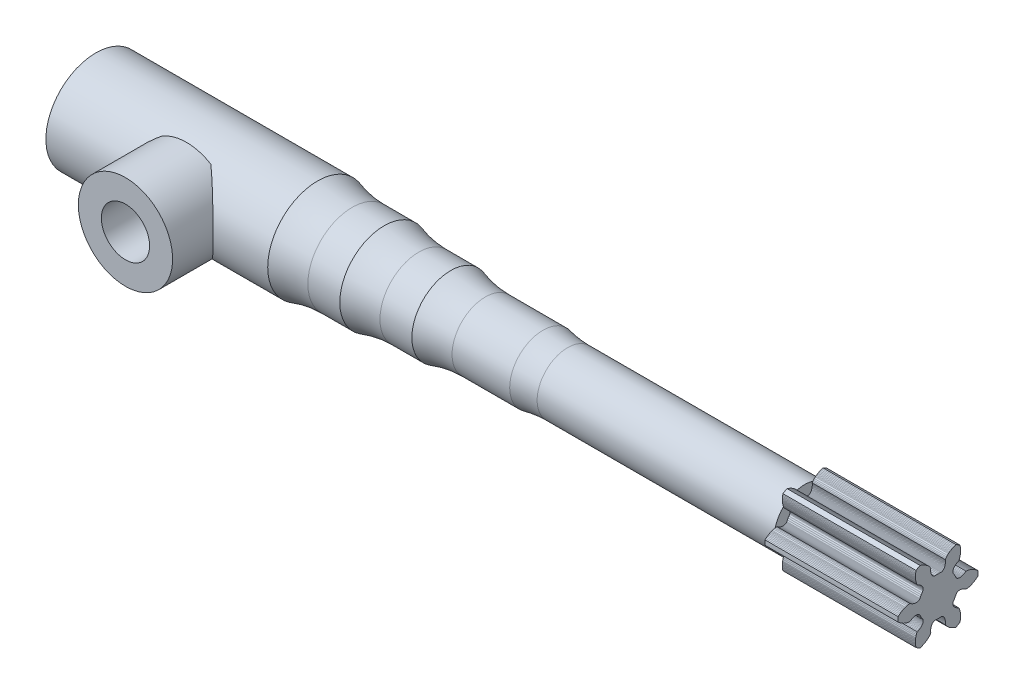
from build123d import *

# Parameters (mm, degrees)
SKETCH1_R           = 4.5
BOSS_EXTRUDE1_DEPTH = 14
SKETCH2_R           = 4.5
BOSS_EXTRUDE2_DEPTH = 6
SKETCH5_R           = 4.25
SKETCH5_R_2         = 2.175
BOSS_EXTRUDE4_DEPTH = 5.5
SKETCH5_2_R         = 2.175
CUT_EXTRUDE2_DEPTH  = 22.711114811
SKETCH3_R           = 4
BOSS_EXTRUDE5_DEPTH = 6
SKETCH6_R           = 3.5
BOSS_EXTRUDE6_DEPTH = 6
SKETCH7_R           = 3
BOSS_EXTRUDE7_DEPTH = 8.32
SKETCH8_R           = 2.75
BOSS_EXTRUDE8_DEPTH = 23.6
BOSS_EXTRUDE9_DEPTH = 12
FILLET1_R           = 10


with BuildPart() as part:
    # Sketch1 → Boss-Extrude1 (new body)
    with BuildSketch(Plane.YZ):
        with Locations(Location((0, 0, 0), (0, 0, 270))):
            Circle(SKETCH1_R)
        with BuildLine():
            Line((-1.509966887, 2.65), (1.509966887, 2.65))
            ThreePointArc((1.509966887, 2.65), (0, -3.05), (-1.509966887, 2.65))
        make_face(mode=Mode.SUBTRACT)
    extrude(amount=BOSS_EXTRUDE1_DEPTH)

    # Sketch2 → Boss-Extrude2 (add)
    with BuildSketch(Plane.YZ.offset(14)):
        with Locations(Location((0, 0, 0), (0, 0, 270))):
            Circle(SKETCH2_R)
    extrude(amount=BOSS_EXTRUDE2_DEPTH)

    # Sketch5 → Boss-Extrude4 (add)
    with BuildSketch(Plane(origin=(0, 0, 2.65), x_dir=(1, 0, 0), z_dir=(0, 0, -1))):
        with Locations(Location((10.825, 0, 0), (0, 0, 180))):
            Circle(SKETCH5_R)
        with Locations(Location((10.825, 0, 0), (0, 0, 180))):
            Circle(SKETCH5_R_2, mode=Mode.SUBTRACT)
    extrude(amount=-BOSS_EXTRUDE4_DEPTH)

    # Sketch5<2> → Cut-Extrude2 (cut, through all)
    with BuildSketch(Plane(origin=(0, 0, 2.65), x_dir=(1, 0, 0), z_dir=(0, 0, -1))):
        with Locations(Location((10.825, 0, 0), (0, 0, 180))):
            Circle(SKETCH5_2_R)
    extrude(amount=-CUT_EXTRUDE2_DEPTH, mode=Mode.SUBTRACT)

    # Sketch3 → Boss-Extrude5 (add)
    with BuildSketch(Plane.YZ.offset(20)):
        with Locations(Location((0, 0, 0), (0, 0, 270))):
            Circle(SKETCH3_R)
    extrude(amount=BOSS_EXTRUDE5_DEPTH)

    # Sketch6 → Boss-Extrude6 (add)
    with BuildSketch(Plane.YZ.offset(26)):
        with Locations(Location((0, 0, 0), (0, 0, 270))):
            Circle(SKETCH6_R)
    extrude(amount=BOSS_EXTRUDE6_DEPTH)

    # Sketch7 → Boss-Extrude7 (add)
    with BuildSketch(Plane.YZ.offset(32)):
        with Locations(Location((0, 0, 0), (0, 0, 270))):
            Circle(SKETCH7_R)
    extrude(amount=BOSS_EXTRUDE7_DEPTH)

    # Sketch8 → Boss-Extrude8 (add)
    with BuildSketch(Plane.YZ.offset(40.32)):
        with Locations(Location((0, 0, 0), (0, 0, 270))):
            Circle(SKETCH8_R)
    extrude(amount=BOSS_EXTRUDE8_DEPTH)

    # Sketch10 → Boss-Extrude9 (add)
    with BuildSketch(Plane.YZ.offset(63.92)):
        with BuildLine():
            Line((-0.267585513, -3.548852444), (-0.329356213, -3.471042444))
            Line((-0.329356213, -3.471042444), (-0.386234913, -3.392939244))
            Line((-0.386234913, -3.392939244), (-0.437003313, -3.316712644))
            Line((-0.437003313, -3.316712644), (-0.483004413, -3.240929044))
            Line((-0.483004413, -3.240929044), (-0.522210513, -3.169795944))
            Line((-0.522210513, -3.169795944), (-0.557776213, -3.098397544))
            Line((-0.557776213, -3.098397544), (-0.587674813, -3.031483444))
            Line((-0.587674813, -3.031483444), (-0.613745313, -2.965878844))
            Line((-0.613745313, -2.965878844), (-0.653275913, -2.844767744))
            Line((-0.653275913, -2.844767744), (-0.677852113, -2.740535144))
            Line((-0.677852113, -2.740535144), (-0.691225313, -2.651038144))
            Line((-0.691225313, -2.651038144), (-0.695897213, -2.578770144))
            Line((-0.695897213, -2.578770144), (-0.695795613, -2.544534244))
            Line((-0.695795613, -2.544534244), (-0.645266113, -2.474114544))
            Line((-0.645266113, -2.474114544), (-0.600691913, -2.402369644))
            Line((-0.600691913, -2.402369644), (-0.563164913, -2.331371144))
            Line((-0.563164913, -2.331371144), (-0.532547213, -2.261579644))
            Line((-0.532547213, -2.261579644), (-0.508658313, -2.193422844))
            Line((-0.508658313, -2.193422844), (-0.491296813, -2.127351744))
            Line((-0.491296813, -2.127351744), (-0.480246213, -2.063791644))
            Line((-0.480246213, -2.063791644), (-0.475252913, -2.003142944))
            Line((-0.475252913, -2.003142944), (-0.476058013, -1.945797444))
            Line((-0.476058013, -1.945797444), (-0.482370713, -1.892131244))
            Line((-0.482370713, -1.892131244), (-0.493862413, -1.842495444))
            Line((-0.493862413, -1.842495444), (-0.510212113, -1.797214044))
            Line((-0.510212113, -1.797214044), (-0.531072813, -1.756625944))
            Line((-0.531072813, -1.756625944), (-0.556074813, -1.720990644))
            Line((-0.556074813, -1.720990644), (-0.584832513, -1.690600344))
            Line((-0.584832513, -1.690600344), (-0.616947313, -1.665684844))
            Line((-0.616947313, -1.665684844), (-0.634136113, -1.655356744))
            Line((-0.634136113, -1.655356744), (-0.751810413, -1.602174544))
            Line((-0.751810413, -1.602174544), (-0.869368213, -1.540110644))
            Line((-0.869368213, -1.540110644), (-0.981896013, -1.469334544))
            Line((-0.981896013, -1.469334544), (-1.086790313, -1.394016744))
            Line((-1.086790313, -1.394016744), (-1.104329113, -1.384294844))
            Line((-1.104329113, -1.384294844), (-1.141963913, -1.368940344))
            Line((-1.141963913, -1.368940344), (-1.182661513, -1.359230644))
            Line((-1.182661513, -1.359230644), (-1.226023613, -1.355395944))
            Line((-1.226023613, -1.355395944), (-1.271604313, -1.357624044))
            Line((-1.271604313, -1.357624044), (-1.318994013, -1.366105444))
            Line((-1.318994013, -1.366105444), (-1.367725713, -1.380971244))
            Line((-1.367725713, -1.380971244), (-1.417358413, -1.402337444))
            Line((-1.417358413, -1.402337444), (-1.467423513, -1.430312944))
            Line((-1.467423513, -1.430312944), (-1.517450213, -1.464961644))
            Line((-1.517450213, -1.464961644), (-1.566969613, -1.506311744))
            Line((-1.566969613, -1.506311744), (-1.615508113, -1.554382844))
            Line((-1.615508113, -1.554382844), (-1.662589213, -1.609149644))
            Line((-1.662589213, -1.609149644), (-1.707721413, -1.670561144))
            Line((-1.707721413, -1.670561144), (-1.750444513, -1.738559644))
            Line((-1.750444513, -1.738559644), (-1.790290313, -1.813034544))
            Line((-1.790290313, -1.813034544), (-1.826010813, -1.892004244))
            Line((-1.826010813, -1.892004244), (-1.855609213, -1.909210144))
            Line((-1.855609213, -1.909210144), (-1.920531113, -1.941298144))
            Line((-1.920531113, -1.941298144), (-2.004724313, -1.974465144))
            Line((-2.004724313, -1.974465144), (-2.107280513, -2.005297744))
            Line((-2.107280513, -2.005297744), (-2.231931113, -2.031618844))
            Line((-2.231931113, -2.031618844), (-2.301781613, -2.041843444))
            Line((-2.301781613, -2.041843444), (-2.374680213, -2.049407544))
            Line((-2.374680213, -2.049407544), (-2.454295913, -2.054305944))
            Line((-2.454295913, -2.054305944), (-2.535502013, -2.055919044))
            Line((-2.535502013, -2.055919044), (-2.624133113, -2.053972644))
            Line((-2.624133113, -2.053972644), (-2.715531513, -2.048119244))
            Line((-2.715531513, -2.048119244), (-2.811610213, -2.037912444))
            Line((-2.811610213, -2.037912444), (-2.909880913, -2.023322444))
            Line((-2.909880913, -2.023322444), (-3.004720513, -2.005193244))
            ThreePointArc((-3.004720513, -2.005193244), (-3.11595463, -1.824967499), (-3.216417616, -1.63852304))
            Line((-3.216417616, -1.63852304), (-3.184698184, -1.547324921))
            Line((-3.184698184, -1.547324921), (-3.148198184, -1.454924921))
            Line((-3.148198184, -1.454924921), (-3.108998184, -1.366614921))
            Line((-3.108998184, -1.366614921), (-3.068368184, -1.284534921))
            Line((-3.068368184, -1.284534921), (-3.025738184, -1.206804921))
            Line((-3.025738184, -1.206804921), (-2.983738184, -1.137284921))
            Line((-2.983738184, -1.137284921), (-2.939688184, -1.070784921))
            Line((-2.939688184, -1.070784921), (-2.896688184, -1.011434921))
            Line((-2.896688184, -1.011434921), (-2.852908184, -0.956054921))
            Line((-2.852908184, -0.956054921), (-2.767788184, -0.861264921))
            Line((-2.767788184, -0.861264921), (-2.689808184, -0.787864921))
            Line((-2.689808184, -0.787864921), (-2.618988184, -0.731534921))
            Line((-2.618988184, -0.731534921), (-2.558738184, -0.691354921))
            Line((-2.558738184, -0.691354921), (-2.529038184, -0.674324921))
            Line((-2.529038184, -0.674324921), (-2.442788184, -0.682874921))
            Line((-2.442788184, -0.682874921), (-2.358368184, -0.685604921))
            Line((-2.358368184, -0.685604921), (-2.278118184, -0.682604921))
            Line((-2.278118184, -0.682604921), (-2.202368184, -0.674224921))
            Line((-2.202368184, -0.674224921), (-2.131398184, -0.660834921))
            Line((-2.131398184, -0.660834921), (-2.065498184, -0.642834921))
            Line((-2.065498184, -0.642834921), (-2.004928184, -0.620624921))
            Line((-2.004928184, -0.620624921), (-1.949908184, -0.594624921))
            Line((-1.949908184, -0.594624921), (-1.900648184, -0.565254921))
            Line((-1.900648184, -0.565254921), (-1.857328184, -0.532954921))
            Line((-1.857328184, -0.532954921), (-1.820088184, -0.498184921))
            Line((-1.820088184, -0.498184921), (-1.789048184, -0.461384921))
            Line((-1.789048184, -0.461384921), (-1.764328184, -0.423024921))
            Line((-1.764328184, -0.423024921), (-1.745968184, -0.383554921))
            Line((-1.745968184, -0.383554921), (-1.734028184, -0.343454921))
            Line((-1.734028184, -0.343454921), (-1.728508184, -0.303184921))
            Line((-1.728508184, -0.303184921), (-1.728158184, -0.283134921))
            Line((-1.728158184, -0.283134921), (-1.740938184, -0.154634921))
            Line((-1.740938184, -0.154634921), (-1.745968184, -0.021794921))
            Line((-1.745968184, -0.021794921), (-1.740938184, 0.111045079))
            Line((-1.740938184, 0.111045079), (-1.728158184, 0.239545079))
            Line((-1.728158184, 0.239545079), (-1.728508184, 0.259595079))
            Line((-1.728508184, 0.259595079), (-1.734028184, 0.299865079))
            Line((-1.734028184, 0.299865079), (-1.745968184, 0.339965079))
            Line((-1.745968184, 0.339965079), (-1.764328184, 0.379435079))
            Line((-1.764328184, 0.379435079), (-1.789048184, 0.417795079))
            Line((-1.789048184, 0.417795079), (-1.820088184, 0.454595079))
            Line((-1.820088184, 0.454595079), (-1.857328184, 0.489365079))
            Line((-1.857328184, 0.489365079), (-1.900648184, 0.521665079))
            Line((-1.900648184, 0.521665079), (-1.949908184, 0.551035079))
            Line((-1.949908184, 0.551035079), (-2.004928184, 0.577035079))
            Line((-2.004928184, 0.577035079), (-2.065498184, 0.599245079))
            Line((-2.065498184, 0.599245079), (-2.131398184, 0.617245079))
            Line((-2.131398184, 0.617245079), (-2.202368184, 0.630635079))
            Line((-2.202368184, 0.630635079), (-2.278118184, 0.639015079))
            Line((-2.278118184, 0.639015079), (-2.358368184, 0.642015079))
            Line((-2.358368184, 0.642015079), (-2.442788184, 0.639285079))
            Line((-2.442788184, 0.639285079), (-2.529038184, 0.630735079))
            Line((-2.529038184, 0.630735079), (-2.558738184, 0.647765079))
            Line((-2.558738184, 0.647765079), (-2.618988184, 0.687945079))
            Line((-2.618988184, 0.687945079), (-2.689808184, 0.744275079))
            Line((-2.689808184, 0.744275079), (-2.767788184, 0.817675079))
            Line((-2.767788184, 0.817675079), (-2.852908184, 0.912465079))
            Line((-2.852908184, 0.912465079), (-2.896688184, 0.967845079))
            Line((-2.896688184, 0.967845079), (-2.939688184, 1.027195079))
            Line((-2.939688184, 1.027195079), (-2.983738184, 1.093695079))
            Line((-2.983738184, 1.093695079), (-3.025738184, 1.163215079))
            Line((-3.025738184, 1.163215079), (-3.068368184, 1.240945079))
            Line((-3.068368184, 1.240945079), (-3.108998184, 1.323025079))
            Line((-3.108998184, 1.323025079), (-3.148198184, 1.411335079))
            Line((-3.148198184, 1.411335079), (-3.184698184, 1.503735079))
            Line((-3.184698184, 1.503735079), (-3.216417684, 1.594933179))
            ThreePointArc((-3.216417684, 1.594933179), (-3.115954701, 1.781377635), (-3.004720588, 1.961603378))
            Line((-3.004720588, 1.961603378), (-2.909880929, 1.979732605))
            Line((-2.909880929, 1.979732605), (-2.811610229, 1.994322605))
            Line((-2.811610229, 1.994322605), (-2.715531529, 2.004529405))
            Line((-2.715531529, 2.004529405), (-2.624133129, 2.010382805))
            Line((-2.624133129, 2.010382805), (-2.535502029, 2.012329205))
            Line((-2.535502029, 2.012329205), (-2.454295929, 2.010716105))
            Line((-2.454295929, 2.010716105), (-2.374680229, 2.005817705))
            Line((-2.374680229, 2.005817705), (-2.301781629, 1.998253605))
            Line((-2.301781629, 1.998253605), (-2.231931129, 1.988029005))
            Line((-2.231931129, 1.988029005), (-2.107280529, 1.961707905))
            Line((-2.107280529, 1.961707905), (-2.004724329, 1.930875305))
            Line((-2.004724329, 1.930875305), (-1.920531129, 1.897708305))
            Line((-1.920531129, 1.897708305), (-1.855609229, 1.865620305))
            Line((-1.855609229, 1.865620305), (-1.826010829, 1.848414405))
            Line((-1.826010829, 1.848414405), (-1.790290329, 1.769444705))
            Line((-1.790290329, 1.769444705), (-1.750444529, 1.694969805))
            Line((-1.750444529, 1.694969805), (-1.707721429, 1.626971305))
            Line((-1.707721429, 1.626971305), (-1.662589229, 1.565559805))
            Line((-1.662589229, 1.565559805), (-1.615508129, 1.510793005))
            Line((-1.615508129, 1.510793005), (-1.566969629, 1.462721905))
            Line((-1.566969629, 1.462721905), (-1.517450229, 1.421371805))
            Line((-1.517450229, 1.421371805), (-1.467423529, 1.386723105))
            Line((-1.467423529, 1.386723105), (-1.417358429, 1.358747605))
            Line((-1.417358429, 1.358747605), (-1.367725729, 1.337381405))
            Line((-1.367725729, 1.337381405), (-1.318994029, 1.322515605))
            Line((-1.318994029, 1.322515605), (-1.271604329, 1.314034205))
            Line((-1.271604329, 1.314034205), (-1.226023629, 1.311806105))
            Line((-1.226023629, 1.311806105), (-1.182661529, 1.315640805))
            Line((-1.182661529, 1.315640805), (-1.141963929, 1.325350505))
            Line((-1.141963929, 1.325350505), (-1.104329129, 1.340705005))
            Line((-1.104329129, 1.340705005), (-1.086790329, 1.350426905))
            Line((-1.086790329, 1.350426905), (-0.981896029, 1.425744705))
            Line((-0.981896029, 1.425744705), (-0.869368229, 1.496520805))
            Line((-0.869368229, 1.496520805), (-0.751810429, 1.558584705))
            Line((-0.751810429, 1.558584705), (-0.634136129, 1.611766905))
            Line((-0.634136129, 1.611766905), (-0.616947329, 1.622095005))
            Line((-0.616947329, 1.622095005), (-0.584832529, 1.647010505))
            Line((-0.584832529, 1.647010505), (-0.556074829, 1.677400805))
            Line((-0.556074829, 1.677400805), (-0.531072829, 1.713036105))
            Line((-0.531072829, 1.713036105), (-0.510212129, 1.753624205))
            Line((-0.510212129, 1.753624205), (-0.493862429, 1.798905605))
            Line((-0.493862429, 1.798905605), (-0.482370729, 1.848541405))
            Line((-0.482370729, 1.848541405), (-0.476058029, 1.902207605))
            Line((-0.476058029, 1.902207605), (-0.475252929, 1.959553105))
            Line((-0.475252929, 1.959553105), (-0.480246229, 2.020201805))
            Line((-0.480246229, 2.020201805), (-0.491296829, 2.083761905))
            Line((-0.491296829, 2.083761905), (-0.508658329, 2.149833005))
            Line((-0.508658329, 2.149833005), (-0.532547229, 2.217989805))
            Line((-0.532547229, 2.217989805), (-0.563164929, 2.287781305))
            Line((-0.563164929, 2.287781305), (-0.600691929, 2.358779805))
            Line((-0.600691929, 2.358779805), (-0.645266129, 2.430524705))
            Line((-0.645266129, 2.430524705), (-0.695795629, 2.500944405))
            Line((-0.695795629, 2.500944405), (-0.695897229, 2.535180305))
            Line((-0.695897229, 2.535180305), (-0.691225329, 2.607448305))
            Line((-0.691225329, 2.607448305), (-0.677852129, 2.696945305))
            Line((-0.677852129, 2.696945305), (-0.653275929, 2.801177905))
            Line((-0.653275929, 2.801177905), (-0.613745329, 2.922289005))
            Line((-0.613745329, 2.922289005), (-0.587674829, 2.987893605))
            Line((-0.587674829, 2.987893605), (-0.557776229, 3.054807705))
            Line((-0.557776229, 3.054807705), (-0.522210529, 3.126206105))
            Line((-0.522210529, 3.126206105), (-0.483004429, 3.197339205))
            Line((-0.483004429, 3.197339205), (-0.437003329, 3.273122805))
            Line((-0.437003329, 3.273122805), (-0.386234929, 3.349349405))
            Line((-0.386234929, 3.349349405), (-0.329356229, 3.427452605))
            Line((-0.329356229, 3.427452605), (-0.267585529, 3.505262605))
            Line((-0.267585529, 3.505262605), (-0.204465329, 3.578331505))
            ThreePointArc((-0.204465329, 3.578331505), (0.007231821, 3.584550218), (0.21892897, 3.578331499))
            Line((0.21892897, 3.578331499), (0.282049071, 3.505262618))
            Line((0.282049071, 3.505262618), (0.343819771, 3.427452618))
            Line((0.343819771, 3.427452618), (0.400698471, 3.349349418))
            Line((0.400698471, 3.349349418), (0.451466871, 3.273122818))
            Line((0.451466871, 3.273122818), (0.497467971, 3.197339218))
            Line((0.497467971, 3.197339218), (0.536674071, 3.126206118))
            Line((0.536674071, 3.126206118), (0.572239771, 3.054807718))
            Line((0.572239771, 3.054807718), (0.602138371, 2.987893618))
            Line((0.602138371, 2.987893618), (0.628208871, 2.922289018))
            Line((0.628208871, 2.922289018), (0.667739471, 2.801177918))
            Line((0.667739471, 2.801177918), (0.692315671, 2.696945318))
            Line((0.692315671, 2.696945318), (0.705688871, 2.607448318))
            Line((0.705688871, 2.607448318), (0.710360771, 2.535180318))
            Line((0.710360771, 2.535180318), (0.710259171, 2.500944418))
            Line((0.710259171, 2.500944418), (0.659729671, 2.430524718))
            Line((0.659729671, 2.430524718), (0.615155471, 2.358779818))
            Line((0.615155471, 2.358779818), (0.577628571, 2.287781318))
            Line((0.577628571, 2.287781318), (0.547010771, 2.217989818))
            Line((0.547010771, 2.217989818), (0.523121871, 2.149833018))
            Line((0.523121871, 2.149833018), (0.505760371, 2.083761918))
            Line((0.505760371, 2.083761918), (0.494709771, 2.020201818))
            Line((0.494709771, 2.020201818), (0.489716471, 1.959553118))
            Line((0.489716471, 1.959553118), (0.490521571, 1.902207618))
            Line((0.490521571, 1.902207618), (0.496834271, 1.848541418))
            Line((0.496834271, 1.848541418), (0.508325971, 1.798905618))
            Line((0.508325971, 1.798905618), (0.524675671, 1.753624218))
            Line((0.524675671, 1.753624218), (0.545536371, 1.713036118))
            Line((0.545536371, 1.713036118), (0.570538471, 1.677400818))
            Line((0.570538471, 1.677400818), (0.599296071, 1.647010518))
            Line((0.599296071, 1.647010518), (0.631410871, 1.622095018))
            Line((0.631410871, 1.622095018), (0.648599671, 1.611766918))
            Line((0.648599671, 1.611766918), (0.766273971, 1.558584718))
            Line((0.766273971, 1.558584718), (0.883831771, 1.496520818))
            Line((0.883831771, 1.496520818), (0.996359571, 1.425744718))
            Line((0.996359571, 1.425744718), (1.101253871, 1.350426918))
            Line((1.101253871, 1.350426918), (1.118792671, 1.340705018))
            Line((1.118792671, 1.340705018), (1.156427471, 1.325350518))
            Line((1.156427471, 1.325350518), (1.197125171, 1.315640818))
            Line((1.197125171, 1.315640818), (1.240487171, 1.311806118))
            Line((1.240487171, 1.311806118), (1.286067871, 1.314034218))
            Line((1.286067871, 1.314034218), (1.333457571, 1.322515618))
            Line((1.333457571, 1.322515618), (1.382189271, 1.337381418))
            Line((1.382189271, 1.337381418), (1.431821971, 1.358747618))
            Line((1.431821971, 1.358747618), (1.481887071, 1.386723118))
            Line((1.481887071, 1.386723118), (1.531913771, 1.421371818))
            Line((1.531913771, 1.421371818), (1.581433171, 1.462721918))
            Line((1.581433171, 1.462721918), (1.629971671, 1.510793018))
            Line((1.629971671, 1.510793018), (1.677052771, 1.565559818))
            Line((1.677052771, 1.565559818), (1.722185071, 1.626971318))
            Line((1.722185071, 1.626971318), (1.764908071, 1.694969818))
            Line((1.764908071, 1.694969818), (1.804753871, 1.769444718))
            Line((1.804753871, 1.769444718), (1.840474371, 1.848414418))
            Line((1.840474371, 1.848414418), (1.870072771, 1.865620318))
            Line((1.870072771, 1.865620318), (1.934994671, 1.897708318))
            Line((1.934994671, 1.897708318), (2.019187871, 1.930875318))
            Line((2.019187871, 1.930875318), (2.121744071, 1.961707918))
            Line((2.121744071, 1.961707918), (2.246394671, 1.988029018))
            Line((2.246394671, 1.988029018), (2.316245171, 1.998253618))
            Line((2.316245171, 1.998253618), (2.389143771, 2.005817718))
            Line((2.389143771, 2.005817718), (2.468759471, 2.010716118))
            Line((2.468759471, 2.010716118), (2.549965571, 2.012329218))
            Line((2.549965571, 2.012329218), (2.638596671, 2.010382818))
            Line((2.638596671, 2.010382818), (2.729995071, 2.004529418))
            Line((2.729995071, 2.004529418), (2.826073771, 1.994322618))
            Line((2.826073771, 1.994322618), (2.924344471, 1.979732618))
            Line((2.924344471, 1.979732618), (3.019184071, 1.961603418))
            ThreePointArc((3.019184071, 1.961603418), (3.130418187, 1.781377677), (3.230881173, 1.59493322))
            Line((3.230881173, 1.59493322), (3.199161741, 1.503735101))
            Line((3.199161741, 1.503735101), (3.162661741, 1.411335101))
            Line((3.162661741, 1.411335101), (3.123461741, 1.323025101))
            Line((3.123461741, 1.323025101), (3.082831741, 1.240945101))
            Line((3.082831741, 1.240945101), (3.040201741, 1.163215101))
            Line((3.040201741, 1.163215101), (2.998201741, 1.093695101))
            Line((2.998201741, 1.093695101), (2.954151741, 1.027195101))
            Line((2.954151741, 1.027195101), (2.911151741, 0.967845101))
            Line((2.911151741, 0.967845101), (2.867371741, 0.912465101))
            Line((2.867371741, 0.912465101), (2.782251741, 0.817675101))
            Line((2.782251741, 0.817675101), (2.704271741, 0.744275101))
            Line((2.704271741, 0.744275101), (2.633451741, 0.687945101))
            Line((2.633451741, 0.687945101), (2.573201741, 0.647765101))
            Line((2.573201741, 0.647765101), (2.543501741, 0.630735101))
            Line((2.543501741, 0.630735101), (2.457251741, 0.639285101))
            Line((2.457251741, 0.639285101), (2.372831741, 0.642015101))
            Line((2.372831741, 0.642015101), (2.292581741, 0.639015101))
            Line((2.292581741, 0.639015101), (2.216831741, 0.630635101))
            Line((2.216831741, 0.630635101), (2.145861741, 0.617245101))
            Line((2.145861741, 0.617245101), (2.079961741, 0.599245101))
            Line((2.079961741, 0.599245101), (2.019391741, 0.577035101))
            Line((2.019391741, 0.577035101), (1.964371741, 0.551035101))
            Line((1.964371741, 0.551035101), (1.915111741, 0.521665101))
            Line((1.915111741, 0.521665101), (1.871791741, 0.489365101))
            Line((1.871791741, 0.489365101), (1.834551741, 0.454595101))
            Line((1.834551741, 0.454595101), (1.803511741, 0.417795101))
            Line((1.803511741, 0.417795101), (1.778791741, 0.379435101))
            Line((1.778791741, 0.379435101), (1.760431741, 0.339965101))
            Line((1.760431741, 0.339965101), (1.748491741, 0.299865101))
            Line((1.748491741, 0.299865101), (1.742971741, 0.259595101))
            Line((1.742971741, 0.259595101), (1.742621741, 0.239545101))
            Line((1.742621741, 0.239545101), (1.755401741, 0.111045101))
            Line((1.755401741, 0.111045101), (1.760431741, -0.021794899))
            Line((1.760431741, -0.021794899), (1.755401741, -0.154634899))
            Line((1.755401741, -0.154634899), (1.742621741, -0.283134899))
            Line((1.742621741, -0.283134899), (1.742971741, -0.303184899))
            Line((1.742971741, -0.303184899), (1.748491741, -0.343454899))
            Line((1.748491741, -0.343454899), (1.760431741, -0.383554899))
            Line((1.760431741, -0.383554899), (1.778791741, -0.423024899))
            Line((1.778791741, -0.423024899), (1.803511741, -0.461384899))
            Line((1.803511741, -0.461384899), (1.834551741, -0.498184899))
            Line((1.834551741, -0.498184899), (1.871791741, -0.532954899))
            Line((1.871791741, -0.532954899), (1.915111741, -0.565254899))
            Line((1.915111741, -0.565254899), (1.964371741, -0.594624899))
            Line((1.964371741, -0.594624899), (2.019391741, -0.620624899))
            Line((2.019391741, -0.620624899), (2.079961741, -0.642834899))
            Line((2.079961741, -0.642834899), (2.145861741, -0.660834899))
            Line((2.145861741, -0.660834899), (2.216831741, -0.674224899))
            Line((2.216831741, -0.674224899), (2.292581741, -0.682604899))
            Line((2.292581741, -0.682604899), (2.372831741, -0.685604899))
            Line((2.372831741, -0.685604899), (2.457251741, -0.682874899))
            Line((2.457251741, -0.682874899), (2.543501741, -0.674324899))
            Line((2.543501741, -0.674324899), (2.573201741, -0.691354899))
            Line((2.573201741, -0.691354899), (2.633451741, -0.731534899))
            Line((2.633451741, -0.731534899), (2.704271741, -0.787864899))
            Line((2.704271741, -0.787864899), (2.782251741, -0.861264899))
            Line((2.782251741, -0.861264899), (2.867371741, -0.956054899))
            Line((2.867371741, -0.956054899), (2.911151741, -1.011434899))
            Line((2.911151741, -1.011434899), (2.954151741, -1.070784899))
            Line((2.954151741, -1.070784899), (2.998201741, -1.137284899))
            Line((2.998201741, -1.137284899), (3.040201741, -1.206804899))
            Line((3.040201741, -1.206804899), (3.082831741, -1.284534899))
            Line((3.082831741, -1.284534899), (3.123461741, -1.366614899))
            Line((3.123461741, -1.366614899), (3.162661741, -1.454924899))
            Line((3.162661741, -1.454924899), (3.199161741, -1.547324899))
            Line((3.199161741, -1.547324899), (3.230881241, -1.638522999))
            ThreePointArc((3.230881241, -1.638522999), (3.130418259, -1.824967455), (3.019184145, -2.005193197))
            Line((3.019184145, -2.005193197), (2.924344487, -2.023322425))
            Line((2.924344487, -2.023322425), (2.826073787, -2.037912425))
            Line((2.826073787, -2.037912425), (2.729995087, -2.048119225))
            Line((2.729995087, -2.048119225), (2.638596687, -2.053972625))
            Line((2.638596687, -2.053972625), (2.549965587, -2.055919025))
            Line((2.549965587, -2.055919025), (2.468759487, -2.054305925))
            Line((2.468759487, -2.054305925), (2.389143787, -2.049407525))
            Line((2.389143787, -2.049407525), (2.316245187, -2.041843425))
            Line((2.316245187, -2.041843425), (2.246394687, -2.031618825))
            Line((2.246394687, -2.031618825), (2.121744087, -2.005297725))
            Line((2.121744087, -2.005297725), (2.019187887, -1.974465125))
            Line((2.019187887, -1.974465125), (1.934994687, -1.941298125))
            Line((1.934994687, -1.941298125), (1.870072787, -1.909210125))
            Line((1.870072787, -1.909210125), (1.840474387, -1.892004225))
            Line((1.840474387, -1.892004225), (1.804753887, -1.813034525))
            Line((1.804753887, -1.813034525), (1.764908087, -1.738559625))
            Line((1.764908087, -1.738559625), (1.722185087, -1.670561125))
            Line((1.722185087, -1.670561125), (1.677052787, -1.609149625))
            Line((1.677052787, -1.609149625), (1.629971687, -1.554382825))
            Line((1.629971687, -1.554382825), (1.581433187, -1.506311725))
            Line((1.581433187, -1.506311725), (1.531913787, -1.464961625))
            Line((1.531913787, -1.464961625), (1.481887087, -1.430312925))
            Line((1.481887087, -1.430312925), (1.431821987, -1.402337425))
            Line((1.431821987, -1.402337425), (1.382189287, -1.380971225))
            Line((1.382189287, -1.380971225), (1.333457587, -1.366105425))
            Line((1.333457587, -1.366105425), (1.286067887, -1.357624025))
            Line((1.286067887, -1.357624025), (1.240487187, -1.355395925))
            Line((1.240487187, -1.355395925), (1.197125187, -1.359230625))
            Line((1.197125187, -1.359230625), (1.156427487, -1.368940325))
            Line((1.156427487, -1.368940325), (1.118792687, -1.384294825))
            Line((1.118792687, -1.384294825), (1.101253887, -1.394016725))
            Line((1.101253887, -1.394016725), (0.996359587, -1.469334525))
            Line((0.996359587, -1.469334525), (0.883831787, -1.540110625))
            Line((0.883831787, -1.540110625), (0.766273987, -1.602174525))
            Line((0.766273987, -1.602174525), (0.648599687, -1.655356725))
            Line((0.648599687, -1.655356725), (0.631410887, -1.665684825))
            Line((0.631410887, -1.665684825), (0.599296087, -1.690600325))
            Line((0.599296087, -1.690600325), (0.570538487, -1.720990625))
            Line((0.570538487, -1.720990625), (0.545536387, -1.756625925))
            Line((0.545536387, -1.756625925), (0.524675687, -1.797214025))
            Line((0.524675687, -1.797214025), (0.508325987, -1.842495425))
            Line((0.508325987, -1.842495425), (0.496834287, -1.892131225))
            Line((0.496834287, -1.892131225), (0.490521587, -1.945797425))
            Line((0.490521587, -1.945797425), (0.489716487, -2.003142925))
            Line((0.489716487, -2.003142925), (0.494709787, -2.063791625))
            Line((0.494709787, -2.063791625), (0.505760387, -2.127351725))
            Line((0.505760387, -2.127351725), (0.523121887, -2.193422825))
            Line((0.523121887, -2.193422825), (0.547010787, -2.261579625))
            Line((0.547010787, -2.261579625), (0.577628587, -2.331371125))
            Line((0.577628587, -2.331371125), (0.615155487, -2.402369625))
            Line((0.615155487, -2.402369625), (0.659729687, -2.474114525))
            Line((0.659729687, -2.474114525), (0.710259187, -2.544534225))
            Line((0.710259187, -2.544534225), (0.710360787, -2.578770125))
            Line((0.710360787, -2.578770125), (0.705688887, -2.651038125))
            Line((0.705688887, -2.651038125), (0.692315687, -2.740535125))
            Line((0.692315687, -2.740535125), (0.667739487, -2.844767725))
            Line((0.667739487, -2.844767725), (0.628208887, -2.965878825))
            Line((0.628208887, -2.965878825), (0.602138387, -3.031483425))
            Line((0.602138387, -3.031483425), (0.572239787, -3.098397525))
            Line((0.572239787, -3.098397525), (0.536674087, -3.169795925))
            Line((0.536674087, -3.169795925), (0.497467987, -3.240929025))
            Line((0.497467987, -3.240929025), (0.451466887, -3.316712625))
            Line((0.451466887, -3.316712625), (0.400698487, -3.392939225))
            Line((0.400698487, -3.392939225), (0.343819787, -3.471042425))
            Line((0.343819787, -3.471042425), (0.282049087, -3.548852425))
            Line((0.282049087, -3.548852425), (0.218928987, -3.621921325))
            ThreePointArc((0.218928987, -3.621921325), (0.007231837, -3.628140044), (-0.204465312, -3.621921331))
            Line((-0.204465312, -3.621921331), (-0.267585513, -3.548852444))
        make_face()
    extrude(amount=BOSS_EXTRUDE9_DEPTH)

    # Fillet1
    # the kernel refuses this fillet: 10 mm, written as the material it adds along each edge
    with BuildSketch(Plane(origin=(20, 0, 0), x_dir=(0, 0, -1), z_dir=(0, -1, 0))) as fillet1_piece_1:
        with BuildLine():
            CenterArc((14, 3.122498999), FILLET1_R, 180, 18.194872339)
            Line((4, 3.122498999), (3.8, 3.122498999))
            Line((3.8, 3.122498999), (3.8, 0))
            Line((3.8, 0), (4, -0.2))
            ThreePointArc((4, -0.2), (4.25, -0.2), (4.31, -0.06244998))
            Line((4.31, -0.06244998), (4.5, 0))
        make_face()
    revolve(axis=Axis((20, 0, 0), (1, 0, 0)))
    with BuildSketch(Plane(origin=(26, 0, 0), x_dir=(0, 0, -1), z_dir=(0, -1, 0))) as fillet1_piece_2:
        with BuildLine():
            CenterArc((13.5, 3.122498999), FILLET1_R, 180, 18.194872339)
            Line((3.5, 3.122498999), (3.3, 3.122498999))
            Line((3.3, 3.122498999), (3.3, 0))
            Line((3.3, 0), (3.5, -0.2))
            ThreePointArc((3.5, -0.2), (3.75, -0.2), (3.81, -0.06244998))
            Line((3.81, -0.06244998), (4, 0))
        make_face()
    revolve(axis=Axis((26, 0, 0), (1, 0, 0)))
    with BuildSketch(Plane(origin=(32, 0, 0), x_dir=(0, 0, -1), z_dir=(0, -1, 0))) as fillet1_piece_3:
        with BuildLine():
            CenterArc((13, 3.122498999), FILLET1_R, 180, 18.194872339)
            Line((3, 3.122498999), (2.8, 3.122498999))
            Line((2.8, 3.122498999), (2.8, 0))
            Line((2.8, 0), (3, -0.2))
            ThreePointArc((3, -0.2), (3.25, -0.2), (3.31, -0.06244998))
            Line((3.31, -0.06244998), (3.5, 0))
        make_face()
    revolve(axis=Axis((32, 0, 0), (1, 0, 0)))
    with BuildSketch(Plane(origin=(40.32, 0, 0), x_dir=(0, 0, -1), z_dir=(0, -1, 0))) as fillet1_piece_4:
        with BuildLine():
            CenterArc((12.75, 2.222048604), FILLET1_R, 180, 12.838568141)
            Line((2.75, 2.222048604), (2.55, 2.222048604))
            Line((2.55, 2.222048604), (2.55, 0))
            Line((2.55, 0), (2.75, -0.2))
            ThreePointArc((2.75, -0.2), (2.875, -0.2), (2.805, -0.044440972))
            Line((2.805, -0.044440972), (3, 0))
        make_face()
    revolve(axis=Axis((40.32, 0, 0), (1, 0, 0)))


solid = part.part
